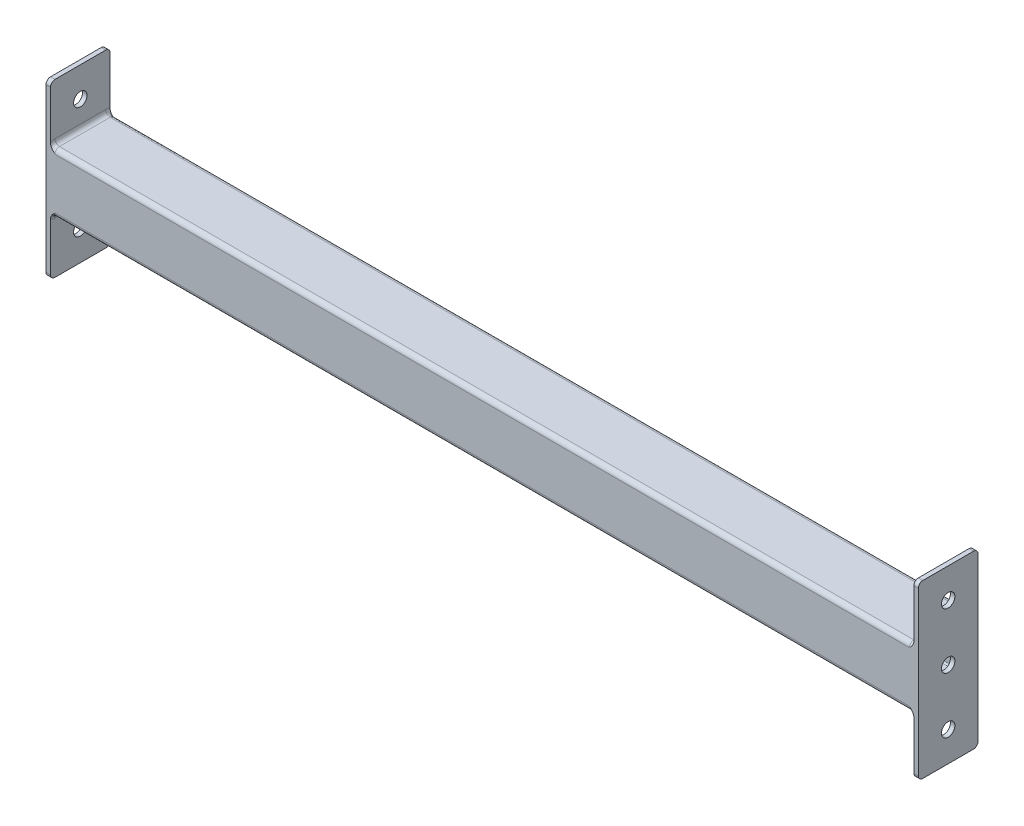
from build123d import *

# Parameters (mm, degrees)
SKETCH1_W           = 40
SKETCH1_H           = 40
SKETCH1_W_2         = 34
SKETCH1_H_2         = 34
BOSS_EXTRUDE1_DEPTH = 289.5
FILLET1_R           = 1
FILLET2_R           = 3
SKETCH2_W           = 40
SKETCH2_H           = 115
SKETCH2_R           = 4.5
BOSS_EXTRUDE2_DEPTH = 3
FILLET3_R           = 3
FILLET4_R           = 3


with BuildPart() as part:
    # Sketch1 → Boss-Extrude1 (new body)
    with BuildSketch(Plane(origin=(0, 0, 0), x_dir=(0, 0, -1), z_dir=(1, 0, 0))):
        Rectangle(SKETCH1_W, SKETCH1_H)
        Rectangle(SKETCH1_W_2, SKETCH1_H_2, mode=Mode.SUBTRACT)
    extrude(amount=BOSS_EXTRUDE1_DEPTH)

    # Fillet1
    fillet1_edges = [part.edges().sort_by_distance(p)[0] for p in [
        (144.75, -17, -17),
        (144.75, 17, -17),
        (144.75, 17, 17),
        (144.75, -17, 17),
    ]]
    fillet(fillet1_edges, radius=FILLET1_R)

    # Fillet2
    fillet2_edges = [part.edges().sort_by_distance(p)[0] for p in [
        (144.75, -20, -20),
        (144.75, -20, 20),
        (144.75, 20, 20),
        (144.75, 20, -20),
    ]]
    fillet(fillet2_edges, radius=FILLET2_R)

    # Sketch2 → Boss-Extrude2 (add)
    with BuildSketch(Plane(origin=(289.5, 0, 0), x_dir=(0, 0, -1), z_dir=(1, 0, 0))):
        Rectangle(SKETCH2_W, SKETCH2_H)
        Circle(SKETCH2_R, mode=Mode.SUBTRACT)
        with Locations((0, -37.5)):
            Circle(SKETCH2_R, mode=Mode.SUBTRACT)
        with Locations((0, 37.5)):
            Circle(SKETCH2_R, mode=Mode.SUBTRACT)
    extrude(amount=BOSS_EXTRUDE2_DEPTH)

    # Fillet3
    # the kernel refuses this fillet: 3 mm, written as the material it adds along each edge
    with BuildSketch(Plane(origin=(289.5, -20, 17), x_dir=(0, -1, 0), z_dir=(0, 0, -1)), Plane(origin=(289.5, 20, -17), x_dir=(0, 1, 0), z_dir=(0, 0, 1))) as fillet3_piece_1:
        with BuildLine():
            CenterArc((FILLET3_R, FILLET3_R), FILLET3_R, 180, 90)
            Line((0, FILLET3_R), (0, 0))
            Line((0, 0), (FILLET3_R, 0))
        make_face()
    extrude(amount=34)
    with BuildSketch(Plane(origin=(289.5, 17, 17), x_dir=(0, 1, 0), z_dir=(0, 0, -1))) as fillet3_piece_2_section:
        with BuildLine():
            CenterArc((3 + FILLET3_R, -FILLET3_R), FILLET3_R, 90, 90)
            Line((3, -FILLET3_R), (3, 0))
            Line((3, 0), (3 + FILLET3_R, 0))
        make_face()
    fillet3_piece_2 = revolve(axis=Axis((289.5, 17, 17), (1, 0, 0)), revolution_arc=233.296989237, mode=Mode.PRIVATE)
    fillet3_piece_2 = split(fillet3_piece_2, bisect_by=Plane(origin=(288.998099396, 20.659325751, 20), z_dir=(0, 0, -1)), keep=Keep.TOP, mode=Mode.PRIVATE)
    fillet3_piece_2 = split(fillet3_piece_2, bisect_by=Plane(origin=(288.998099396, 20.659325751, 17), z_dir=(0, 0, 1)), keep=Keep.TOP, mode=Mode.PRIVATE)
    add(fillet3_piece_2)
    with BuildSketch(Plane(origin=(289.5, 17, -17), x_dir=(0, -0.5976672776328276, 0.8017442392976482), z_dir=(0, 0.8017442392976482, 0.5976672776328276))) as fillet3_piece_3_section:
        with BuildLine():
            CenterArc((3 + FILLET3_R, -FILLET3_R), FILLET3_R, 90, 90)
            Line((3, -FILLET3_R), (3, 0))
            Line((3, 0), (3 + FILLET3_R, 0))
        make_face()
    fillet3_piece_3 = revolve(axis=Axis((289.5, 17, -17), (1, 0, 0)), revolution_arc=233.296989237, mode=Mode.PRIVATE)
    fillet3_piece_3 = split(fillet3_piece_3, bisect_by=Plane(origin=(288.565115083, 19.249816872, -20), z_dir=(0, 0, 1)), keep=Keep.TOP, mode=Mode.PRIVATE)
    fillet3_piece_3 = split(fillet3_piece_3, bisect_by=Plane(origin=(288.565115083, 19.249816872, -17), z_dir=(0, 0, -1)), keep=Keep.TOP, mode=Mode.PRIVATE)
    add(fillet3_piece_3)
    with BuildSketch(Plane(origin=(289.5, -17, -17), x_dir=(0, -1, 0), z_dir=(0, 0, 1))) as fillet3_piece_4_section:
        with BuildLine():
            CenterArc((3 + FILLET3_R, -FILLET3_R), FILLET3_R, 90, 90)
            Line((3, -FILLET3_R), (3, 0))
            Line((3, 0), (3 + FILLET3_R, 0))
        make_face()
    fillet3_piece_4 = revolve(axis=Axis((289.5, -17, -17), (1, 0, 0)), revolution_arc=233.296989237, mode=Mode.PRIVATE)
    fillet3_piece_4 = split(fillet3_piece_4, bisect_by=Plane(origin=(288.998099396, -20.659325751, -20), z_dir=(0, 0, 1)), keep=Keep.TOP, mode=Mode.PRIVATE)
    fillet3_piece_4 = split(fillet3_piece_4, bisect_by=Plane(origin=(288.998099396, -20.659325751, -17), z_dir=(0, 0, -1)), keep=Keep.TOP, mode=Mode.PRIVATE)
    add(fillet3_piece_4)
    with BuildSketch(Plane(origin=(289.5, -17, 17), x_dir=(0, -1, 0), z_dir=(0, 0, -1))) as fillet3_piece_5_section:
        with BuildLine():
            CenterArc((3 + FILLET3_R, FILLET3_R), FILLET3_R, 180, 90)
            Line((3, FILLET3_R), (3, 0))
            Line((3, 0), (3 + FILLET3_R, 0))
        make_face()
    fillet3_piece_5 = revolve(axis=Axis((289.5, -17, 17), (-1, 0, 0)), revolution_arc=233.296989237, mode=Mode.PRIVATE)
    fillet3_piece_5 = split(fillet3_piece_5, bisect_by=Plane(origin=(288.998099366, -20.659325736, 20), z_dir=(0, 0, -1)), keep=Keep.TOP, mode=Mode.PRIVATE)
    fillet3_piece_5 = split(fillet3_piece_5, bisect_by=Plane(origin=(288.998099366, -20.659325736, 17), z_dir=(0, 0, 1)), keep=Keep.TOP, mode=Mode.PRIVATE)
    add(fillet3_piece_5)

    # Fillet4
    fillet4_edges = [part.edges().sort_by_distance(p)[0] for p in [
        (291, -57.5, -20),
        (291, 57.5, -20),
        (291, 57.5, 20),
        (291, -57.5, 20),
    ]]
    fillet(fillet4_edges, radius=FILLET4_R)

    # Mirror1: part across plane


with BuildPart() as part_1:
    add(part.part)
    add(part.part.mirror(Plane(origin=(0, 0, 0), x_dir=(0, 0, 1), z_dir=(1, 0, 0))))


solid = part_1.part
